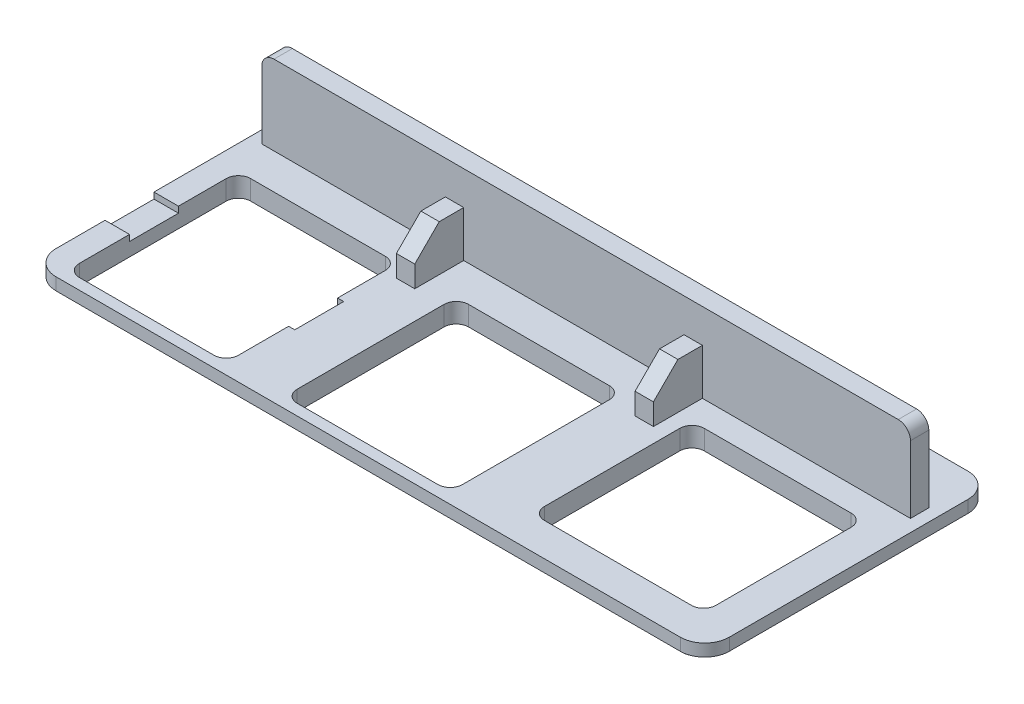
from build123d import *

# Parameters (mm, degrees)
SKETCH_1_W          = 55
SKETCH_1_H          = 23.5
EXTRUDE_1_DEPTH     = 1
FILLET_1_R          = 2
SKETCH_2_W          = 53
SKETCH_2_H          = 22.3
EXTRUDE_2_DEPTH     = 0.6
SKETCH_3_W          = 13
SKETCH_3_H          = 14
SKETCH_3_W_2        = 13.5
SKETCH_3_W_3        = 14
SKETCH_3_H_2        = 13.05
CUT_EXTRUDE_1_DEPTH = 3
FILLET_2_R          = 1
SKETCH_4_W          = 15.5
SKETCH_4_H          = 3.997435945
CUT_EXTRUDE_2_DEPTH = 0.5
SKETCH_5_W          = 53
SKETCH_5_H          = 1.5
EXTRUDE_3_DEPTH     = 6.5
FILLET_3_R          = 1
SKETCH_6_W          = 1.5
SKETCH_6_H          = 4
EXTRUDE_4_DEPTH     = 3.75
CHAMFER_1_SIZE      = 2
FILLET_4_R          = 1.5


with BuildPart() as part:
    # 草图1 → 凸台-拉伸1 (new body)
    with BuildSketch(Plane(origin=(0, 0, 0), x_dir=(1, 0, 0), z_dir=(0, 1, 0))):
        Rectangle(SKETCH_1_W, SKETCH_1_H)
    extrude(amount=EXTRUDE_1_DEPTH)

    # 圆角1
    fillet_1_edges = [part.edges().sort_by_distance(p)[0] for p in [
        (-27.5, 0.5, 11.75),
        (27.5, 0.5, 11.75),
        (-27.5, 0.5, -11.75),
        (27.5, 0.5, -11.75),
    ]]
    fillet(fillet_1_edges, radius=FILLET_1_R)

    # 草图2 → 凸台-拉伸2 (add)
    with BuildSketch(Plane.XZ):
        Rectangle(SKETCH_2_W, SKETCH_2_H)
    extrude(amount=EXTRUDE_2_DEPTH)

    # 草图3 → 切除-拉伸1 (cut)
    with BuildSketch(Plane.XZ.offset(0.6)):
        with Locations((-19, 3.85)):
            Rectangle(SKETCH_3_W, SKETCH_3_H)
        with Locations((-0.95, 3.85)):
            Rectangle(SKETCH_3_W_2, SKETCH_3_H)
        with Locations((17.7, 2.516421356)):
            Rectangle(SKETCH_3_W_3, SKETCH_3_H_2)
    extrude(amount=-CUT_EXTRUDE_1_DEPTH, mode=Mode.SUBTRACT)

    # 圆角2
    fillet_2_edges = [part.edges().sort_by_distance(p)[0] for p in [
        (-25.5, 0.2, 10.85),
        (-12.5, 0.2, 10.85),
        (-7.7, 0.2, 10.85),
        (5.8, 0.2, 10.85),
        (24.7, 0.2, 9.041421356),
        (10.7, 0.2, 9.041421356),
        (24.7, 0.2, -4.008578644),
        (10.7, 0.2, -4.008578644),
        (5.8, 0.2, -3.15),
        (-7.7, 0.2, -3.15),
        (-12.5, 0.2, -3.15),
        (-25.5, 0.2, -3.15),
    ]]
    fillet(fillet_2_edges, radius=FILLET_2_R)

    # 草图4 → 切除-拉伸2 (cut)
    with BuildSketch(Plane(origin=(0, 1, 0), x_dir=(1, 0, 0), z_dir=(0, 1, 0))):
        with Locations((-19.75, -3.751282028)):
            Rectangle(SKETCH_4_W, SKETCH_4_H)
    extrude(amount=-CUT_EXTRUDE_2_DEPTH, mode=Mode.SUBTRACT)

    # 草图5 → 凸台-拉伸3 (add)
    with BuildSketch(Plane(origin=(0, 1, 0), x_dir=(1, 0, 0), z_dir=(0, 1, 0))):
        with Locations((0, 6.804632487)):
            Rectangle(SKETCH_5_W, SKETCH_5_H)
    extrude(amount=EXTRUDE_3_DEPTH)

    # 圆角3
    fillet_3_edges = [part.edges().sort_by_distance(p)[0] for p in [
        (-26.5, 7.5, -6.804632487),
        (26.5, 7.5, -6.804632487),
    ]]
    fillet(fillet_3_edges, radius=FILLET_3_R)

    # 草图6 → 凸台-拉伸4 (add)
    with BuildSketch(Plane(origin=(0, 1, 0), x_dir=(1, 0, 0), z_dir=(0, 1, 0))):
        with Locations((8.75, 4.054632487)):
            Rectangle(SKETCH_6_W, SKETCH_6_H)
        with Locations((-10.75, 4.054632487)):
            Rectangle(SKETCH_6_W, SKETCH_6_H)
    extrude(amount=EXTRUDE_4_DEPTH)

    # 倒角1
    chamfer_1_edges = [part.edges().sort_by_distance(p)[0] for p in [
        (-10.75, 4.75, -2.054632487),
        (8.75, 4.75, -2.054632487),
    ]]
    chamfer(chamfer_1_edges, length=CHAMFER_1_SIZE)

    # 圆角4
    fillet_4_edges = [part.edges().sort_by_distance(p)[0] for p in [
        (-26.5, -0.3, -11.15),
        (26.5, -0.3, -11.15),
        (26.5, -0.3, 11.15),
        (-26.5, -0.3, 11.15),
    ]]
    fillet(fillet_4_edges, radius=FILLET_4_R)


solid = part.part
